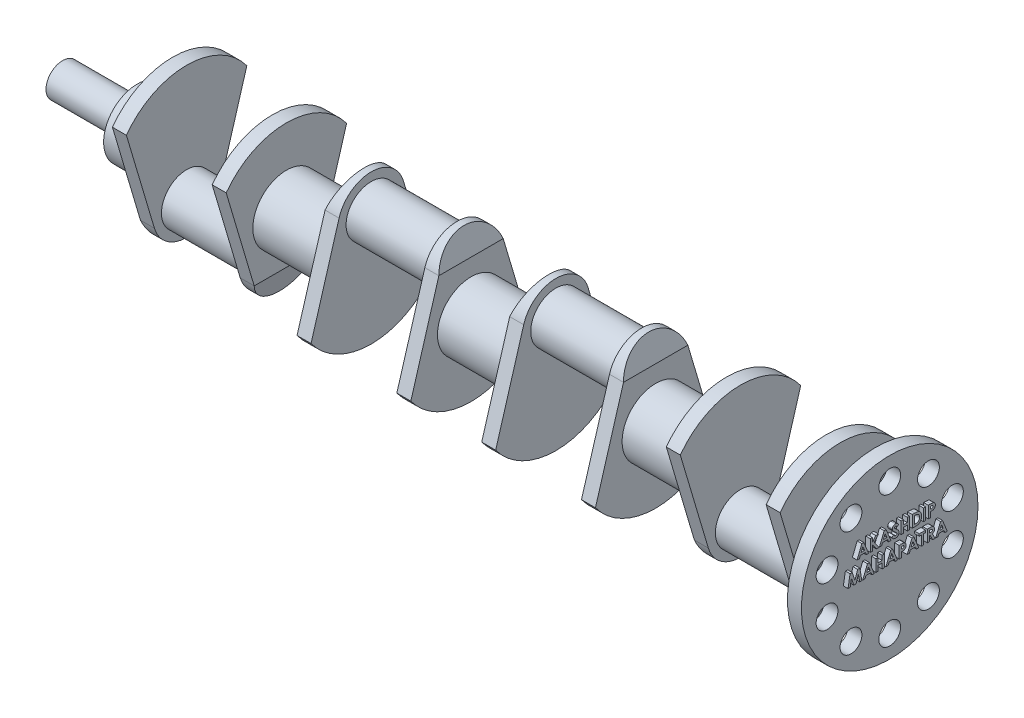
from build123d import *

# Parameters (mm, degrees)
SKETCH1_R               = 36
BOSS_EXTRUDE1_DEPTH     = 38
SKETCH3_R               = 27
BOSS_EXTRUDE2_DEPTH     = 15
SKETCH3_2_R             = 27
BOSS_EXTRUDE3_DEPTH     = 61
CUT_EXTRUDE1_DEPTH      = 143.724458813
CUT_EXTRUDE1_DEPTH_BACK = 143.724458813
BODY_MOVE_COPY1_ANGLE   = 180
SKETCH5_R               = 94.662126669
SKETCH5_R_2             = 11.708716401
BOSS_EXTRUDE4_DEPTH     = 15
SKETCH6_R               = 17.793512753
BOSS_EXTRUDE5_DEPTH     = 80
WRAP1_OUTLINE_W         = 2.279487179
WRAP1_OUTLINE_H         = 12.7
WRAP1_DEPTH             = 5


# Read off the part's stored shape, not the designer's step: Wrap1
with BuildPart() as part:
    # Sketch1 → Boss-Extrude1 (new body)
    with BuildSketch(Plane(origin=(0, 0, 0), x_dir=(0, 0, -1), z_dir=(1, 0, 0))):
        Circle(SKETCH1_R)
    extrude(amount=BOSS_EXTRUDE1_DEPTH)

    # Sketch3 → Boss-Extrude2 (add)
    with BuildSketch(Plane(origin=(38, 0, 0), x_dir=(0, 0, -1), z_dir=(1, 0, 0))):
        with BuildLine():
            Line((-34.517510455, -54.224552409), (-64.569893475, 47.23059238))
            ThreePointArc((-64.569893475, 47.23059238), (0, 80), (64.569893475, 47.23059238))
            Line((64.569893475, 47.23059238), (34.517510455, -54.224552409))
            ThreePointArc((34.517510455, -54.224552409), (0, -80), (-34.517510455, -54.224552409))
        make_face()
        with Locations(Location((0, -44, 0), (0, 0, 144.817798311))):
            Circle(SKETCH3_R, mode=Mode.SUBTRACT)
    extrude(amount=BOSS_EXTRUDE2_DEPTH)

    # Sketch3<2> → Boss-Extrude3 (add)
    with BuildSketch(Plane(origin=(38, 0, 0), x_dir=(0, 0, -1), z_dir=(1, 0, 0))):
        with Locations(Location((0, -44, 0), (0, 0, 180))):
            Circle(SKETCH3_2_R)
    extrude(amount=BOSS_EXTRUDE3_DEPTH)

    # Sketch4 → Cut-Extrude1 (cut, two sides: drawn at the far end of the back side and taken through both)
    with BuildSketch(Plane.XY.offset(-CUT_EXTRUDE1_DEPTH_BACK)):
        Polygon((38, -54.224552409), (45.5, -80), (38, -80), align=None)
    extrude(amount=CUT_EXTRUDE1_DEPTH + CUT_EXTRUDE1_DEPTH_BACK, mode=Mode.SUBTRACT)

    # Mirror1: part across plane


with BuildPart() as part_1:
    add(part.part)
    add(part.part.mirror(Plane(origin=(99, 0, 0), x_dir=(0, 0, 1), z_dir=(1, 0, 0))))


with BuildPart() as body_2:
    # Mirror2: mirrored copy
    add(part_1.part.mirror(Plane(origin=(198, 0, 0), x_dir=(0, 0, 1), z_dir=(1, 0, 0))))


with BuildPart() as body_2_1:
    # Body-Move/Copy1: moved
    add(body_2.part.rotate(Axis((0, 0, 0), (1, 0, 0)), BODY_MOVE_COPY1_ANGLE))

    # Combine1: union part
    add(part_1.part)

    # Mirror3: body 2 across plane


with BuildPart() as body_2_2:
    add(body_2_1.part)
    add(body_2_1.part.mirror(Plane(origin=(396, 0, 0), x_dir=(0, 0, 1), z_dir=(1, 0, 0))))

    # Sketch5 → Boss-Extrude4 (add)
    with BuildSketch(Plane(origin=(792, 0, 0), x_dir=(0, 0, -1), z_dir=(1, 0, 0))):
        Circle(SKETCH5_R)
        with Locations((0, 70.666718743)):
            Circle(SKETCH5_R_2, mode=Mode.SUBTRACT)
        with Locations((41.536855105, 57.1705764)):
            Circle(SKETCH5_R_2, mode=Mode.SUBTRACT)
        with Locations((67.208043346, 21.837217028)):
            Circle(SKETCH5_R_2, mode=Mode.SUBTRACT)
        with Locations((67.208043346, -21.837217028)):
            Circle(SKETCH5_R_2, mode=Mode.SUBTRACT)
        with Locations((41.536855105, -57.1705764)):
            Circle(SKETCH5_R_2, mode=Mode.SUBTRACT)
        with Locations((0, -70.666718743)):
            Circle(SKETCH5_R_2, mode=Mode.SUBTRACT)
        with Locations((-41.536855105, -57.1705764)):
            Circle(SKETCH5_R_2, mode=Mode.SUBTRACT)
        with Locations((-67.208043346, -21.837217028)):
            Circle(SKETCH5_R_2, mode=Mode.SUBTRACT)
        with Locations((-67.208043346, 21.837217028)):
            Circle(SKETCH5_R_2, mode=Mode.SUBTRACT)
        with Locations((-41.536855105, 57.1705764)):
            Circle(SKETCH5_R_2, mode=Mode.SUBTRACT)
    extrude(amount=BOSS_EXTRUDE4_DEPTH)

    # Sketch6 → Boss-Extrude5 (add)
    with BuildSketch(Plane.ZY):
        Circle(SKETCH6_R)
    extrude(amount=BOSS_EXTRUDE5_DEPTH)

    # Wrap1 outline → Wrap1 (add)
    # profile 1 of 17: a face of its own
    with BuildSketch(Plane(origin=(807, 0, 0), x_dir=(0, 0, -1), z_dir=(1, 0, 0))):
        with BuildLine():
            add(Edge.make_bspline(
                [(2.972212954, 29.383808048), (2.899198316, 29.486802786), (2.759020393, 29.68453832), (2.5318066, 29.94931086), (2.305618794, 30.175181541), (2.078361483, 30.361206779), (1.848020343, 30.506256333), (1.614995214, 30.60895302), (1.38060718, 30.674238278), (1.223134603, 30.682367863), (1.145570326, 30.686372151)],
                knots=[0, 0, 0, 0, 0.162420307, 0.31182434, 0.448432767, 0.573381197, 0.689077147, 0.797572901, 0.900293043, 1, 1, 1, 1], degree=3))
            Line((2.972212954, 29.383808048), (4.676740198, 30.943323272))
            add(Edge.make_bspline(
                [(1.171011031, 32.96585933), (1.320645634, 32.960385378), (1.618733676, 32.949480682), (2.059465444, 32.864209525), (2.489953807, 32.730111649), (2.836849399, 32.568337315), (3.112867746, 32.411626441), (3.324410025, 32.267346808), (3.539665681, 32.102066735), (3.760370616, 31.91526538), (3.982423792, 31.703423159), (4.212139242, 31.471583144), (4.446386812, 31.217741695), (4.598610591, 31.036398541), (4.676740198, 30.943323272)],
                knots=[0, 0, 0, 0, 0.10691022, 0.212976528, 0.319776676, 0.428556273, 0.485856803, 0.546558687, 0.611431498, 0.67982091, 0.753158505, 0.830752869, 0.913133075, 1, 1, 1, 1], degree=3))
            add(Edge.make_bspline(
                [(-2.161721341, 29.745066061), (-2.158966549, 29.853796648), (-2.153539314, 30.068007584), (-2.105127541, 30.382973554), (-2.032774301, 30.68688925), (-1.927696625, 30.97864585), (-1.791318489, 31.257877917), (-1.62569254, 31.525952409), (-1.428246921, 31.780402029), (-1.205739038, 32.021058095), (-0.960592319, 32.240990354), (-0.698621897, 32.435102608), (-0.421310546, 32.599052642), (-0.130354718, 32.735061099), (0.176048521, 32.839166933), (0.49564191, 32.912962337), (0.828883849, 32.95685349), (1.055547823, 32.962819983), (1.171011031, 32.96585933)],
                knots=[0, 0, 0, 0, 0.06317288, 0.12445736, 0.184840915, 0.244566821, 0.304319173, 0.365199786, 0.427420983, 0.491261689, 0.555499002, 0.618604518, 0.680494764, 0.742473305, 0.804990665, 0.868251971, 0.932887217, 1, 1, 1, 1], degree=3))
            add(Edge.make_bspline(
                [(1.038719364, 25.287854522), (0.877069822, 25.424625536), (0.566815423, 25.687130508), (0.128386595, 26.074842089), (-0.266677035, 26.437194087), (-0.614963275, 26.778665964), (-0.920909828, 27.092951528), (-1.182444692, 27.382603525), (-1.396694789, 27.649856224), (-1.622146817, 27.966399161), (-1.836371319, 28.352128481), (-2.021522081, 28.816205569), (-2.141640081, 29.280223772), (-2.155097632, 29.591740036), (-2.161721341, 29.745066061)],
                knots=[0, 0, 0, 0, 0.112124581, 0.215201009, 0.309902452, 0.395959096, 0.473447494, 0.542140328, 0.602523333, 0.654726333, 0.747804055, 0.835278417, 0.918925243, 1, 1, 1, 1], degree=3))
            add(Edge.make_bspline(
                [(2.722894044, 23.097409811), (2.718712332, 23.169878781), (2.710217585, 23.317092555), (2.647647893, 23.535975765), (2.54983238, 23.754759431), (2.434109731, 23.934211713), (2.316347444, 24.084462245), (2.203740137, 24.214647534), (2.066614226, 24.358479487), (1.9053174, 24.516139033), (1.721980813, 24.689014091), (1.516450026, 24.87708773), (1.286371495, 25.078703248), (1.123751536, 25.216041746), (1.038719364, 25.287854522)],
                knots=[0, 0, 0, 0, 0.076346606, 0.155090822, 0.238351561, 0.32840414, 0.37938386, 0.439617644, 0.509831416, 0.588874645, 0.677436354, 0.77554672, 0.882635872, 1, 1, 1, 1], degree=3))
            add(Edge.make_bspline(
                [(1.272773852, 21.894064458), (1.371612549, 21.898061749), (1.563374015, 21.905817076), (1.837088971, 21.97745069), (2.088041206, 22.089920719), (2.304962464, 22.250399941), (2.488637709, 22.435617354), (2.624200583, 22.641680195), (2.709362094, 22.864635214), (2.718365731, 23.019514437), (2.722894044, 23.097409811)],
                knots=[0, 0, 0, 0, 0.141985893, 0.275473311, 0.404345843, 0.535429711, 0.661427401, 0.77786684, 0.888279749, 1, 1, 1, 1], degree=3))
            add(Edge.make_bspline(
                [(-0.808275828, 23.522269586), (-0.734257286, 23.393607651), (-0.592357416, 23.146951724), (-0.351894821, 22.815538224), (-0.105553168, 22.531737421), (0.152362741, 22.300565511), (0.418716745, 22.118931429), (0.694795396, 21.989123113), (0.980792661, 21.908771912), (1.175601005, 21.898959175), (1.272773852, 21.894064458)],
                knots=[0, 0, 0, 0, 0.160457921, 0.307611547, 0.442138888, 0.566229194, 0.681222208, 0.789558005, 0.895028892, 1, 1, 1, 1], degree=3))
            Line((-0.808275828, 23.522269586), (-2.813003392, 22.318924234))
            add(Edge.make_bspline(
                [(1.188819525, 19.614577279), (1.080200932, 19.616504245), (0.865073826, 19.620320743), (0.548008996, 19.651479274), (0.241847059, 19.701765828), (-0.053067118, 19.773841481), (-0.338062178, 19.86517111), (-0.613149824, 19.976726752), (-0.876431035, 20.110237479), (-1.129897921, 20.262957779), (-1.372318321, 20.440286165), (-1.606757545, 20.638597215), (-1.83088692, 20.860941042), (-2.045782894, 21.106791812), (-2.250070503, 21.376845715), (-2.450436813, 21.66734175), (-2.637976943, 21.983671129), (-2.753828823, 22.205578748), (-2.813003392, 22.318924234)],
                knots=[0, 0, 0, 0, 0.063551482, 0.125868382, 0.18624025, 0.244976651, 0.303357688, 0.361230317, 0.418489049, 0.475936712, 0.534203744, 0.594059429, 0.655468694, 0.718771685, 0.784974607, 0.853522316, 0.925182451, 1, 1, 1, 1], degree=3))
            add(Edge.make_bspline(
                [(5.002381223, 23.229701478), (5.000107905, 23.101437205), (4.995647568, 22.84977793), (4.941017003, 22.481512066), (4.863117023, 22.129065652), (4.742669988, 21.796273802), (4.595869855, 21.477673839), (4.411834686, 21.178228539), (4.195710615, 20.894907392), (3.947999246, 20.63277511), (3.674001057, 20.394908233), (3.380111959, 20.183153521), (3.063458156, 20.008323033), (2.726745089, 19.864362597), (2.370152993, 19.753482345), (1.994106675, 19.671531504), (1.598030949, 19.622345901), (1.327188659, 19.61720413), (1.188819525, 19.614577279)],
                knots=[0, 0, 0, 0, 0.065200875, 0.127926544, 0.18904691, 0.248543693, 0.307607127, 0.36724766, 0.426963056, 0.488617128, 0.550391855, 0.611330734, 0.672556085, 0.734024191, 0.797340621, 0.862249627, 0.929625466, 1, 1, 1, 1], degree=3))
            add(Edge.make_bspline(
                [(3.689640839, 26.142662215), (3.801762188, 26.021322902), (4.017298797, 25.78806613), (4.297420407, 25.426591491), (4.527969553, 25.073718538), (4.706326744, 24.722807392), (4.841029268, 24.368795106), (4.935996332, 24.002999546), (4.992872739, 23.621598378), (4.999187348, 23.361338641), (5.002381223, 23.229701478)],
                knots=[0, 0, 0, 0, 0.150833097, 0.289954183, 0.417138648, 0.535255184, 0.648751095, 0.762405462, 0.879826701, 1, 1, 1, 1], degree=3))
            add(Edge.make_bspline(
                [(2.053803499, 27.60804683), (2.160634631, 27.515589874), (2.363377924, 27.340125781), (2.651841369, 27.091082672), (2.905352694, 26.86702466), (3.12760498, 26.671314375), (3.3152291, 26.501898369), (3.469013826, 26.357966835), (3.590837379, 26.242321856), (3.660086935, 26.172472218), (3.689640839, 26.142662215)],
                knots=[0, 0, 0, 0, 0.192952702, 0.366184141, 0.520457298, 0.655012135, 0.770624226, 0.865677185, 0.942674527, 1, 1, 1, 1], degree=3))
            add(Edge.make_bspline(
                [(0.328923691, 29.24642824), (0.358130834, 29.209555599), (0.42536182, 29.124679647), (0.55355754, 28.99024937), (0.714544441, 28.825560513), (0.914517638, 28.636276245), (1.145175693, 28.415589162), (1.417209906, 28.172174558), (1.722789945, 27.898494165), (1.939989157, 27.70791305), (2.053803499, 27.60804683)],
                knots=[0, 0, 0, 0, 0.059234189, 0.136349281, 0.233805212, 0.349411224, 0.48317915, 0.635966856, 0.809243356, 1, 1, 1, 1], degree=3))
            add(Edge.make_bspline(
                [(0.117765839, 29.854461093), (0.120009374, 29.80160011), (0.124527542, 29.695145435), (0.168166897, 29.539122852), (0.233943866, 29.386670625), (0.296796444, 29.293865701), (0.328923691, 29.24642824)],
                knots=[0, 0, 0, 0, 0.241881375, 0.487115475, 0.73783784, 1, 1, 1, 1], degree=3))
            add(Edge.make_bspline(
                [(1.145570326, 30.686372151), (1.073220594, 30.683834851), (0.933532269, 30.678935991), (0.7343962, 30.630241691), (0.557600361, 30.546202481), (0.403317298, 30.436314143), (0.28110235, 30.303924172), (0.183523191, 30.165081133), (0.128577926, 30.011829819), (0.121346047, 29.906570634), (0.117765839, 29.854461093)],
                knots=[0, 0, 0, 0, 0.148126258, 0.285992887, 0.416634394, 0.547379946, 0.671582838, 0.784400739, 0.893265576, 1, 1, 1, 1], degree=3))
        make_face()
    # profile 2 of 17: a face of its own
    with BuildSketch(Plane(origin=(807, 0, 0), x_dir=(0, 0, -1), z_dir=(1, 0, 0))):
        with BuildLine():
            add(Edge.make_bspline(
                [(22.040021448, 32.640218304), (22.263946809, 32.63865299), (22.696797065, 32.635627218), (23.323911453, 32.601534051), (23.907048032, 32.54910118), (24.446582703, 32.476970263), (24.941409334, 32.381521308), (25.390889855, 32.261799302), (25.79653283, 32.123600162), (26.162786052, 31.960980832), (26.497140015, 31.771382842), (26.814619775, 31.560185904), (27.114601966, 31.319653255), (27.401296365, 31.05442525), (27.671003119, 30.759649624), (27.928213812, 30.44020893), (28.166630759, 30.091470836), (28.393460789, 29.721796983), (28.598598368, 29.329620727), (28.777527029, 28.918280192), (28.927416654, 28.490422507), (29.049209736, 28.045591687), (29.146292878, 27.585264435), (29.214219996, 27.108511854), (29.256213218, 26.615775336), (29.260473079, 26.281823605), (29.262637634, 26.112133369)],
                knots=[0, 0, 0, 0, 0.060148162, 0.116267077, 0.168653955, 0.217398969, 0.262433523, 0.303932701, 0.342259967, 0.377441339, 0.411406099, 0.445398351, 0.479766387, 0.514584482, 0.550213651, 0.587000908, 0.624662987, 0.663615456, 0.703456428, 0.743450162, 0.784013386, 0.825132536, 0.867264663, 0.910306473, 0.954424205, 1, 1, 1, 1], degree=3))
            Line((22.040021448, 32.640218304), (19.167765839, 32.640218304))
            Line((19.167765839, 32.640218304), (19.167765839, 19.940218304))
            Line((19.167765839, 19.940218304), (22.083270647, 19.940218304))
            add(Edge.make_bspline(
                [(29.262637634, 26.112133369), (29.25696966, 25.872689399), (29.245811923, 25.401329929), (29.151825379, 24.709615338), (28.999817313, 24.046537912), (28.786080166, 23.417284499), (28.52110332, 22.827458695), (28.204558805, 22.287461829), (27.841087902, 21.800192332), (27.434925067, 21.368076407), (26.995149638, 20.996666912), (26.538134286, 20.678581859), (26.059426848, 20.427745253), (25.637618695, 20.268677335), (25.271858402, 20.169750852), (24.950724822, 20.111284348), (24.585949841, 20.057667037), (24.174132251, 20.016232733), (23.717078604, 19.979283516), (23.212967079, 19.95920675), (22.663429846, 19.942525937), (22.281724279, 19.941007671), (22.083270647, 19.940218304)],
                knots=[0, 0, 0, 0, 0.065772947, 0.129477895, 0.191430088, 0.252445668, 0.311786958, 0.36881755, 0.424091518, 0.478492106, 0.531393744, 0.58200397, 0.631201271, 0.679503008, 0.705561374, 0.735221723, 0.769132486, 0.80685832, 0.848929771, 0.895116661, 0.945469804, 1, 1, 1, 1], degree=3))
        make_face()
        with BuildLine():
            add(Edge.make_bspline(
                [(22.637878018, 22.219705484), (22.779544108, 22.219965075), (23.05201516, 22.220464355), (23.445401682, 22.244245481), (23.809184468, 22.268115174), (24.142362111, 22.31342065), (24.447359372, 22.363887762), (24.719986389, 22.434119658), (24.965863188, 22.507892316), (25.181986433, 22.601814053), (25.379937716, 22.707529219), (25.563217993, 22.831386791), (25.740134775, 22.968925954), (25.90738046, 23.12419193), (26.065588032, 23.295128705), (26.213821436, 23.482617042), (26.354059195, 23.686084908), (26.482701671, 23.906608087), (26.600255855, 24.141857806), (26.704539588, 24.389555327), (26.791006191, 24.651763438), (26.862871938, 24.926027555), (26.914228163, 25.214735459), (26.956715644, 25.51574873), (26.978619178, 25.830259957), (26.981625302, 26.044263908), (26.983150454, 26.152838497)],
                knots=[0, 0, 0, 0, 0.062614648, 0.120428813, 0.174199486, 0.223724664, 0.26902845, 0.310765001, 0.348115258, 0.382378114, 0.414753161, 0.447195432, 0.480044579, 0.513738641, 0.547962504, 0.582917814, 0.619315101, 0.657123545, 0.695686576, 0.735513716, 0.7758232, 0.817652262, 0.860742584, 0.905386927, 0.951998197, 1, 1, 1, 1], degree=3))
            Line((22.637878018, 22.219705484), (21.447253018, 22.219705484))
            Line((21.447253018, 22.219705484), (21.447253018, 30.360731125))
            Line((21.447253018, 30.360731125), (22.317325134, 30.360731125))
            add(Edge.make_bspline(
                [(25.784893243, 29.34310292), (25.690433567, 29.425777998), (25.497510374, 29.594632484), (25.158800647, 29.796963339), (24.785560069, 29.974730828), (24.369250015, 30.115680621), (23.913893938, 30.227149727), (23.416779727, 30.304027243), (22.880569537, 30.35342792), (22.509095611, 30.358244568), (22.317325134, 30.360731125)],
                knots=[0, 0, 0, 0, 0.101663476, 0.207636138, 0.318744567, 0.436679942, 0.563506646, 0.698681208, 0.844446556, 1, 1, 1, 1], degree=3))
            add(Edge.make_bspline(
                [(26.983150454, 26.152838497), (26.980112869, 26.31921879), (26.974189812, 26.643647471), (26.917069134, 27.116184925), (26.824087567, 27.561149728), (26.691411829, 27.976890495), (26.524169949, 28.364575677), (26.314827752, 28.720920758), (26.072394519, 29.051911845), (25.880684932, 29.246081838), (25.784893243, 29.34310292)],
                knots=[0, 0, 0, 0, 0.142276686, 0.277428514, 0.406477152, 0.530595072, 0.650142922, 0.766850697, 0.883502093, 1, 1, 1, 1], degree=3))
        make_face(mode=Mode.SUBTRACT)
    # profile 3 of 17: a face of its own
    with BuildSketch(Plane(origin=(807, 0, 0), x_dir=(0, 0, -1), z_dir=(1, 0, 0))):
        with BuildLine():
            add(Edge.make_bspline(
                [(38.970810711, 32.640218304), (39.137036978, 32.63947424), (39.45772229, 32.638038785), (39.920176894, 32.620631975), (40.346813909, 32.589437911), (40.737535316, 32.550886981), (41.09218046, 32.496840078), (41.411193464, 32.434879535), (41.694640529, 32.359393561), (41.945717944, 32.269792755), (42.171051813, 32.164156906), (42.384290331, 32.051647186), (42.580614282, 31.917370804), (42.76993273, 31.775799497), (42.941422013, 31.613409014), (43.105780658, 31.441006676), (43.256047629, 31.251755148), (43.392919207, 31.04794527), (43.517082819, 30.833342576), (43.625560457, 30.60756342), (43.713551442, 30.370250531), (43.787364937, 30.122939053), (43.846652655, 29.865639764), (43.886116448, 29.596770251), (43.912922241, 29.318207863), (43.915287482, 29.128618126), (43.916483788, 29.032726317)],
                knots=[0, 0, 0, 0, 0.070781161, 0.136551696, 0.197012482, 0.252922694, 0.303686532, 0.349719151, 0.391240471, 0.428478555, 0.463056565, 0.497150358, 0.531002334, 0.564226377, 0.59770067, 0.631421421, 0.665597347, 0.700451436, 0.735880684, 0.771092108, 0.806974845, 0.843534403, 0.880940196, 0.919294384, 0.95918024, 1, 1, 1, 1], degree=3))
            Line((38.970810711, 32.640218304), (36.426740198, 32.640218304))
            Line((36.426740198, 32.640218304), (36.426740198, 19.940218304))
            Line((36.426740198, 19.940218304), (38.706227377, 19.940218304))
            Line((38.706227377, 19.940218304), (38.706227377, 25.47611574))
            add(Edge.make_bspline(
                [(41.293547089, 25.669465099), (41.228442459, 25.653266962), (41.087404865, 25.61817658), (40.854026385, 25.582551036), (40.585082191, 25.549795538), (40.279702609, 25.521646153), (39.937711582, 25.50251113), (39.559440246, 25.487567528), (39.144717174, 25.476701987), (38.85633515, 25.476316429), (38.706227377, 25.47611574)],
                knots=[0, 0, 0, 0, 0.077372749, 0.167614291, 0.272108317, 0.390015992, 0.52136331, 0.667272254, 0.826809521, 1, 1, 1, 1], degree=3))
            add(Edge.make_bspline(
                [(43.916483788, 29.032726317), (43.914752883, 28.926643492), (43.911351444, 28.718177704), (43.878006373, 28.412592436), (43.821042458, 28.121244549), (43.7465936, 27.841677056), (43.642779962, 27.578489461), (43.524177756, 27.325402028), (43.378259423, 27.089510551), (43.2115244, 26.867864312), (43.029430733, 26.658661223), (42.827655527, 26.467941627), (42.610044702, 26.294405395), (42.377857932, 26.136233854), (42.130223516, 25.993746072), (41.867320135, 25.865607801), (41.587352535, 25.7559173), (41.392391523, 25.698550057), (41.293547089, 25.669465099)],
                knots=[0, 0, 0, 0, 0.068875425, 0.135348675, 0.199289315, 0.26155008, 0.322915384, 0.382771997, 0.442843572, 0.502652029, 0.562748843, 0.622739582, 0.682687332, 0.743329247, 0.805012514, 0.86806712, 0.933110571, 1, 1, 1, 1], degree=3))
        make_face()
        with BuildLine():
            add(Edge.make_bspline(
                [(39.51269773, 27.75560292), (39.659447743, 27.756533429), (39.929469947, 27.758245579), (40.298224924, 27.783004269), (40.594563517, 27.820815788), (40.828676508, 27.875046252), (41.013530889, 27.957348162), (41.17295622, 28.052555973), (41.309699396, 28.172943636), (41.428098859, 28.310507141), (41.522755663, 28.468574502), (41.588395225, 28.644571901), (41.631033395, 28.834801442), (41.634971426, 28.967188612), (41.636996608, 29.035270388)],
                knots=[0, 0, 0, 0, 0.155159592, 0.285495954, 0.390502806, 0.470975045, 0.538445527, 0.60365534, 0.666587169, 0.73019895, 0.794944675, 0.860228437, 0.928120706, 1, 1, 1, 1], degree=3))
            Line((39.51269773, 27.75560292), (38.706227377, 27.75560292))
            Line((38.706227377, 27.75560292), (38.706227377, 30.360731125))
            Line((38.706227377, 30.360731125), (39.423655262, 30.360731125))
            add(Edge.make_bspline(
                [(41.039140038, 30.108868144), (40.99882373, 30.129257257), (40.913465844, 30.172425187), (40.76809309, 30.222611063), (40.600335152, 30.264948377), (40.409059474, 30.300087939), (40.19502911, 30.327359888), (39.958282247, 30.348216107), (39.69847049, 30.356603205), (39.517786958, 30.3593172), (39.423655262, 30.360731125)],
                knots=[0, 0, 0, 0, 0.08210116, 0.173824981, 0.278953094, 0.396639095, 0.527315592, 0.671298143, 0.82875438, 1, 1, 1, 1], degree=3))
            add(Edge.make_bspline(
                [(41.636996608, 29.035270388), (41.634992258, 29.094752549), (41.631103336, 29.210162243), (41.602534257, 29.376727058), (41.557003365, 29.531999826), (41.491030851, 29.674358929), (41.405744013, 29.803562476), (41.301762098, 29.919559569), (41.180419399, 30.024834384), (41.08673574, 30.080557952), (41.039140038, 30.108868144)],
                knots=[0, 0, 0, 0, 0.137787685, 0.267341238, 0.390444331, 0.511777883, 0.629508981, 0.747829066, 0.87188531, 1, 1, 1, 1], degree=3))
        make_face(mode=Mode.SUBTRACT)
    # profile 4 of 17: a face of its own
    with BuildSketch(Plane(origin=(807, 0, 0), x_dir=(0, 0, -1), z_dir=(1, 0, 0))):
        with BuildLine():
            add(Edge.make_bspline(
                [(7.709272249, 10.962013176), (7.875498516, 10.961269112), (8.196183828, 10.959833656), (8.658638432, 10.942426846), (9.085275447, 10.911232783), (9.475996854, 10.872681853), (9.830641999, 10.81863495), (10.149655002, 10.756674407), (10.433102068, 10.681188432), (10.684179482, 10.591587627), (10.909513352, 10.485951778), (11.122751869, 10.373442058), (11.31907582, 10.239165676), (11.508394268, 10.097594369), (11.679883551, 9.935203886), (11.844242196, 9.762801548), (11.994509168, 9.57355002), (12.131380746, 9.369740141), (12.255544358, 9.155137447), (12.364021995, 8.929358292), (12.45201298, 8.692045402), (12.525826475, 8.444733924), (12.585114193, 8.187434636), (12.624577986, 7.918565123), (12.651383779, 7.640002735), (12.65374902, 7.450412998), (12.654945326, 7.354521189)],
                knots=[0, 0, 0, 0, 0.070781161, 0.136551696, 0.197012482, 0.252922694, 0.303686532, 0.349719151, 0.391240471, 0.428478555, 0.463056565, 0.497150358, 0.531002334, 0.564226377, 0.59770067, 0.631421421, 0.665597347, 0.700451436, 0.735880684, 0.771092108, 0.806974845, 0.843534403, 0.880940196, 0.919294384, 0.95918024, 1, 1, 1, 1], degree=3))
            Line((7.709272249, 10.962013176), (5.165201736, 10.962013176))
            Line((5.165201736, 10.962013176), (5.165201736, -1.737986824))
            Line((5.165201736, -1.737986824), (7.444688916, -1.737986824))
            Line((7.444688916, -1.737986824), (7.444688916, 3.797910612))
            add(Edge.make_bspline(
                [(10.032008627, 3.991259971), (9.966903997, 3.975061834), (9.825866403, 3.939971452), (9.592487924, 3.904345907), (9.323543729, 3.871590409), (9.018164148, 3.843441024), (8.676173121, 3.824306002), (8.297901784, 3.8093624), (7.883178713, 3.798496858), (7.594796689, 3.798111301), (7.444688916, 3.797910612)],
                knots=[0, 0, 0, 0, 0.077372749, 0.167614291, 0.272108317, 0.390015992, 0.52136331, 0.667272254, 0.826809521, 1, 1, 1, 1], degree=3))
            add(Edge.make_bspline(
                [(12.654945326, 7.354521189), (12.653214422, 7.248438364), (12.649812982, 7.039972576), (12.616467912, 6.734387307), (12.559503996, 6.443039421), (12.485055138, 6.163471928), (12.381241501, 5.900284333), (12.262639294, 5.6471969), (12.116720961, 5.411305423), (11.949985939, 5.189659184), (11.767892272, 4.980456095), (11.566117065, 4.789736499), (11.348506241, 4.616200267), (11.11631947, 4.458028726), (10.868685054, 4.315540944), (10.605781673, 4.187402672), (10.325814074, 4.077712172), (10.130853061, 4.020344928), (10.032008627, 3.991259971)],
                knots=[0, 0, 0, 0, 0.068875425, 0.135348675, 0.199289315, 0.26155008, 0.322915384, 0.382771997, 0.442843572, 0.502652029, 0.562748843, 0.622739582, 0.682687332, 0.743329247, 0.805012514, 0.86806712, 0.933110571, 1, 1, 1, 1], degree=3))
        make_face()
        with BuildLine():
            add(Edge.make_bspline(
                [(8.251159268, 6.077397792), (8.397909281, 6.078328301), (8.667931485, 6.080040451), (9.036686462, 6.10479914), (9.333025055, 6.14261066), (9.567138047, 6.196841124), (9.751992428, 6.279143033), (9.911417758, 6.374350844), (10.048160934, 6.494738508), (10.166560398, 6.632302013), (10.261217201, 6.790369374), (10.326856764, 6.966366772), (10.369494933, 7.156596314), (10.373432964, 7.288983483), (10.375458147, 7.35706526)],
                knots=[0, 0, 0, 0, 0.155159592, 0.285495954, 0.390502806, 0.470975045, 0.538445527, 0.60365534, 0.666587169, 0.73019895, 0.794944675, 0.860228437, 0.928120706, 1, 1, 1, 1], degree=3))
            Line((8.251159268, 6.077397792), (7.444688916, 6.077397792))
            Line((7.444688916, 6.077397792), (7.444688916, 8.682525997))
            Line((7.444688916, 8.682525997), (8.1621168, 8.682525997))
            add(Edge.make_bspline(
                [(9.777601576, 8.430663016), (9.737285268, 8.451052129), (9.651927383, 8.494220059), (9.506554629, 8.544405934), (9.33879669, 8.586743249), (9.147521012, 8.621882811), (8.933490649, 8.64915476), (8.696743786, 8.670010979), (8.436932028, 8.678398077), (8.256248497, 8.681112072), (8.1621168, 8.682525997)],
                knots=[0, 0, 0, 0, 0.08210116, 0.173824981, 0.278953094, 0.396639095, 0.527315592, 0.671298143, 0.82875438, 1, 1, 1, 1], degree=3))
            add(Edge.make_bspline(
                [(10.375458147, 7.35706526), (10.373453796, 7.416547421), (10.369564874, 7.531957115), (10.340995796, 7.698521929), (10.295464903, 7.853794698), (10.22949239, 7.9961538), (10.144205552, 8.125357347), (10.040223637, 8.241354441), (9.918880937, 8.346629256), (9.825197279, 8.402352824), (9.777601576, 8.430663016)],
                knots=[0, 0, 0, 0, 0.137787685, 0.267341238, 0.390444331, 0.511777883, 0.629508981, 0.747829066, 0.87188531, 1, 1, 1, 1], degree=3))
        make_face(mode=Mode.SUBTRACT)
    # profile 5 of 17: a face of its own
    with BuildSketch(Plane(origin=(807, 0, 0), x_dir=(0, 0, -1), z_dir=(1, 0, 0))):
        with BuildLine():
            add(Edge.make_bspline(
                [(37.943006223, 10.962013176), (38.118567651, 10.961390034), (38.456221728, 10.960191556), (38.943100465, 10.941282745), (39.390365542, 10.914969582), (39.798679175, 10.874814997), (40.167866681, 10.821574871), (40.498298071, 10.758813573), (40.789963689, 10.687283618), (41.045323329, 10.598151651), (41.275772778, 10.497612143), (41.490583703, 10.382090405), (41.694495152, 10.252872808), (41.886144198, 10.106559287), (42.067196316, 9.945781986), (42.237993071, 9.770379067), (42.396120948, 9.578863186), (42.540600812, 9.37244448), (42.672282578, 9.155296735), (42.788661641, 8.927121805), (42.883301288, 8.687761011), (42.966925562, 8.440673632), (43.027157417, 8.182327507), (43.069047791, 7.915237678), (43.099718284, 7.638463961), (43.101481691, 7.450436187), (43.102381223, 7.354521189)],
                knots=[0, 0, 0, 0, 0.072889027, 0.14018613, 0.202277434, 0.258895132, 0.310482942, 0.357095244, 0.398513567, 0.435037511, 0.469251486, 0.502805028, 0.536210446, 0.56937936, 0.602801475, 0.636665798, 0.670928657, 0.705803, 0.741189061, 0.776304311, 0.812004301, 0.847968976, 0.884521761, 0.921974159, 0.960198176, 1, 1, 1, 1], degree=3))
            Line((37.943006223, 10.962013176), (35.286996608, 10.962013176))
            Line((35.286996608, 10.962013176), (35.286996608, -1.737986824))
            Line((35.286996608, -1.737986824), (37.566483788, -1.737986824))
            Line((37.566483788, -1.737986824), (37.566483788, 3.797910612))
            Line((37.566483788, 3.797910612), (38.339881223, 3.797910612))
            Line((38.339881223, 3.797910612), (41.138358788, -1.737986824))
            Line((41.138358788, -1.737986824), (43.672253018, -1.737986824))
            Line((43.672253018, -1.737986824), (40.741483788, 4.057405804))
            add(Edge.make_bspline(
                [(43.102381223, 7.354521189), (43.100044561, 7.254407965), (43.095462791, 7.058104179), (43.070782886, 6.769749928), (43.025675773, 6.493872751), (42.957354488, 6.23128038), (42.878828045, 5.97870455), (42.774408019, 5.74080544), (42.6565597, 5.514123155), (42.516594694, 5.301864199), (42.362989937, 5.099313879), (42.184350837, 4.914232647), (41.992250461, 4.73667309), (41.77589015, 4.577756934), (41.544807267, 4.426738844), (41.294410437, 4.289876237), (41.026333836, 4.163728702), (40.837862709, 4.093380122), (40.741483788, 4.057405804)],
                knots=[0, 0, 0, 0, 0.068741263, 0.134789088, 0.19853605, 0.260385651, 0.320961578, 0.37990385, 0.438502936, 0.496154344, 0.554265483, 0.612748761, 0.672513443, 0.733646402, 0.796789619, 0.861935699, 0.929397735, 1, 1, 1, 1], degree=3))
        make_face()
        with BuildLine():
            add(Edge.make_bspline(
                [(38.454364397, 6.077397792), (38.562915181, 6.078620364), (38.77076661, 6.080961326), (39.069684264, 6.09181968), (39.341172781, 6.117982949), (39.586398026, 6.151039261), (39.80659395, 6.189207547), (39.999796481, 6.243905018), (40.168982577, 6.302514743), (40.312147377, 6.375351427), (40.434464092, 6.458182535), (40.540076746, 6.552280733), (40.627433554, 6.661187415), (40.699332663, 6.781942968), (40.755262353, 6.915615444), (40.796086742, 7.060737423), (40.818901538, 7.218962031), (40.821526458, 7.328158555), (40.822894044, 7.385050035)],
                knots=[0, 0, 0, 0, 0.105539996, 0.202086415, 0.290684899, 0.37055261, 0.442670262, 0.507674928, 0.565573203, 0.616454666, 0.663331357, 0.708862024, 0.7534118, 0.798515011, 0.845064321, 0.893873119, 0.944707806, 1, 1, 1, 1], degree=3))
            Line((38.454364397, 6.077397792), (37.566483788, 6.077397792))
            Line((37.566483788, 6.077397792), (37.566483788, 8.682525997))
            Line((37.566483788, 8.682525997), (38.342425294, 8.682525997))
            add(Edge.make_bspline(
                [(40.822894044, 7.385050035), (40.820308498, 7.45235681), (40.815229673, 7.584568496), (40.764831945, 7.774906965), (40.68460965, 7.951078241), (40.574646855, 8.112286338), (40.436163011, 8.253612484), (40.277241873, 8.378192608), (40.094453541, 8.476701248), (39.925205301, 8.541676498), (39.771228962, 8.58055186), (39.632270175, 8.609521437), (39.471355062, 8.630053007), (39.288362142, 8.651830392), (39.083757871, 8.665951924), (38.856427031, 8.676257827), (38.607022517, 8.680474478), (38.433163882, 8.681822468), (38.342425294, 8.682525997)],
                knots=[0, 0, 0, 0, 0.06376896, 0.125262305, 0.185413583, 0.246806762, 0.309422389, 0.372532682, 0.437733251, 0.505749517, 0.544013263, 0.588369599, 0.640389019, 0.697897401, 0.763271619, 0.834978604, 0.913873656, 1, 1, 1, 1], degree=3))
        make_face(mode=Mode.SUBTRACT)
    # profile 6 of 17: a face of its own
    with BuildSketch(Plane(origin=(807, 0, 0), x_dir=(0, 0, -1), z_dir=(1, 0, 0))):
        Polygon((-27.643131597, 19.940218304), (-32.771977751, 32.640218304), (-34.886100347, 32.640218304), (-40.017490571, 19.940218304), (-37.585359161, 19.940218304), (-36.598259802, 22.54534651), (-31.064906437, 22.54534651), (-30.077807078, 19.940218304), align=None)
        Polygon((-31.927346341, 24.824833689), (-35.733275828, 24.824833689), (-33.830311084, 29.233707888), align=None, mode=Mode.SUBTRACT)
    # profile 7 of 17: a face of its own
    with BuildSketch(Plane(origin=(807, 0, 0), x_dir=(0, 0, -1), z_dir=(1, 0, 0))):
        Polygon((-19.316388809, 19.940218304), (-16.571336725, 19.940218304), (-21.537362366, 27.022910612), (-17.011460924, 32.640218304), (-19.888804674, 32.640218304), (-23.49120852, 28.170286413), (-23.49120852, 32.640218304), (-25.7706957, 32.640218304), (-25.7706957, 19.940218304), (-23.49120852, 19.940218304), (-23.49120852, 25.895887375), align=None)
    # profile 8 of 17: a face of its own
    with BuildSketch(Plane(origin=(807, 0, 0), x_dir=(0, 0, -1), z_dir=(1, 0, 0))):
        Polygon((-6.143191693, 19.940218304), (-3.708516212, 19.940218304), (-8.837362366, 32.640218304), (-10.951484962, 32.640218304), (-16.082875187, 19.940218304), (-13.650743777, 19.940218304), (-12.663644418, 22.54534651), (-7.130291052, 22.54534651), align=None)
        Polygon((-7.992730956, 24.824833689), (-11.798660443, 24.824833689), (-9.8956957, 29.233707888), align=None, mode=Mode.SUBTRACT)
    # profile 9 of 17: a face of its own
    with BuildSketch(Plane(origin=(807, 0, 0), x_dir=(0, 0, -1), z_dir=(1, 0, 0))):
        Polygon((13.957509429, 19.940218304), (16.236996608, 19.940218304), (16.236996608, 32.640218304), (13.957509429, 32.640218304), (13.957509429, 27.75560292), (9.561355582, 27.75560292), (9.561355582, 32.640218304), (7.281868403, 32.640218304), (7.281868403, 19.940218304), (9.561355582, 19.940218304), (9.561355582, 25.47611574), (13.957509429, 25.47611574), align=None)
    # profile 10 of 17: a face of its own
    with BuildSketch(Plane(origin=(807, 0, 0), x_dir=(0, 0, -1), z_dir=(1, 0, 0))):
        with Locations((32.356227378, 26.290218304)):
            Rectangle(WRAP1_OUTLINE_W, WRAP1_OUTLINE_H)
    # profile 11 of 17: a face of its own
    with BuildSketch(Plane(origin=(807, 0, 0), x_dir=(0, 0, -1), z_dir=(1, 0, 0))):
        Polygon((33.495970967, 8.682525997), (33.495970967, 10.962013176), (26.657509429, 10.962013176), (26.657509429, 8.682525997), (28.936996608, 8.682525997), (28.936996608, -1.737986824), (31.216483788, -1.737986824), (31.216483788, 8.682525997), align=None)
    # profile 12 of 17: a face of its own
    with BuildSketch(Plane(origin=(807, 0, 0), x_dir=(0, 0, -1), z_dir=(1, 0, 0))):
        Polygon((-42.296977751, 2.103559651), (-45.194674065, 10.962013176), (-47.560659642, 10.962013176), (-49.705311084, -1.737986824), (-47.395295059, -1.737986824), (-46.041849546, 6.283467503), (-43.416368777, -1.737986824), (-41.192851148, -1.737986824), (-38.552105956, 6.283467503), (-37.196116373, -1.737986824), (-34.888644418, -1.737986824), (-37.03583993, 10.962013176), (-39.378928873, 10.962013176), align=None)
    # profile 13 of 17: a face of its own
    with BuildSketch(Plane(origin=(807, 0, 0), x_dir=(0, 0, -1), z_dir=(1, 0, 0))):
        Polygon((-26.747618777, 10.962013176), (-28.861741373, 10.962013176), (-33.993131597, -1.737986824), (-31.561000187, -1.737986824), (-30.573900828, 0.867141381), (-25.040547462, 0.867141381), (-24.053448103, -1.737986824), (-21.618772623, -1.737986824), align=None)
        Polygon((-25.902987366, 3.146628561), (-29.708916853, 3.146628561), (-27.80595211, 7.55550276), align=None, mode=Mode.SUBTRACT)
    # profile 14 of 17: a face of its own
    with BuildSketch(Plane(origin=(807, 0, 0), x_dir=(0, 0, -1), z_dir=(1, 0, 0))):
        Polygon((-10.79120852, 10.962013176), (-13.0706957, 10.962013176), (-13.0706957, 6.077397792), (-17.466849546, 6.077397792), (-17.466849546, 10.962013176), (-19.746336725, 10.962013176), (-19.746336725, -1.737986824), (-17.466849546, -1.737986824), (-17.466849546, 3.797910612), (-13.0706957, 3.797910612), (-13.0706957, -1.737986824), (-10.79120852, -1.737986824), align=None)
    # profile 15 of 17: a face of its own
    with BuildSketch(Plane(origin=(807, 0, 0), x_dir=(0, 0, -1), z_dir=(1, 0, 0))):
        Polygon((-1.836080315, 10.962013176), (-3.950202911, 10.962013176), (-9.081593136, -1.737986824), (-6.649461725, -1.737986824), (-5.662362366, 0.867141381), (-0.129009001, 0.867141381), (0.858090358, -1.737986824), (3.292765839, -1.737986824), align=None)
        Polygon((-0.991448905, 3.146628561), (-4.797378392, 3.146628561), (-2.894413648, 7.55550276), align=None, mode=Mode.SUBTRACT)
    # profile 16 of 17: a face of its own
    with BuildSketch(Plane(origin=(807, 0, 0), x_dir=(0, 0, -1), z_dir=(1, 0, 0))):
        Polygon((20.95879148, 10.962013176), (18.844668884, 10.962013176), (13.713278659, -1.737986824), (16.14541007, -1.737986824), (17.132509429, 0.867141381), (22.665862794, 0.867141381), (23.652962153, -1.737986824), (26.087637634, -1.737986824), align=None)
        Polygon((21.80342289, 3.146628561), (17.997493403, 3.146628561), (19.900458147, 7.55550276), align=None, mode=Mode.SUBTRACT)
    # profile 17 of 17: a face of its own
    with BuildSketch(Plane(origin=(807, 0, 0), x_dir=(0, 0, -1), z_dir=(1, 0, 0))):
        Polygon((51.56904789, 10.962013176), (49.454925294, 10.962013176), (44.32353507, -1.737986824), (46.75566648, -1.737986824), (47.742765839, 0.867141381), (53.276119204, 0.867141381), (54.263218563, -1.737986824), (56.697894044, -1.737986824), align=None)
        Polygon((52.4136793, 3.146628561), (48.607749813, 3.146628561), (50.510714557, 7.55550276), align=None, mode=Mode.SUBTRACT)
    extrude(amount=WRAP1_DEPTH)


solid = body_2_2.part
